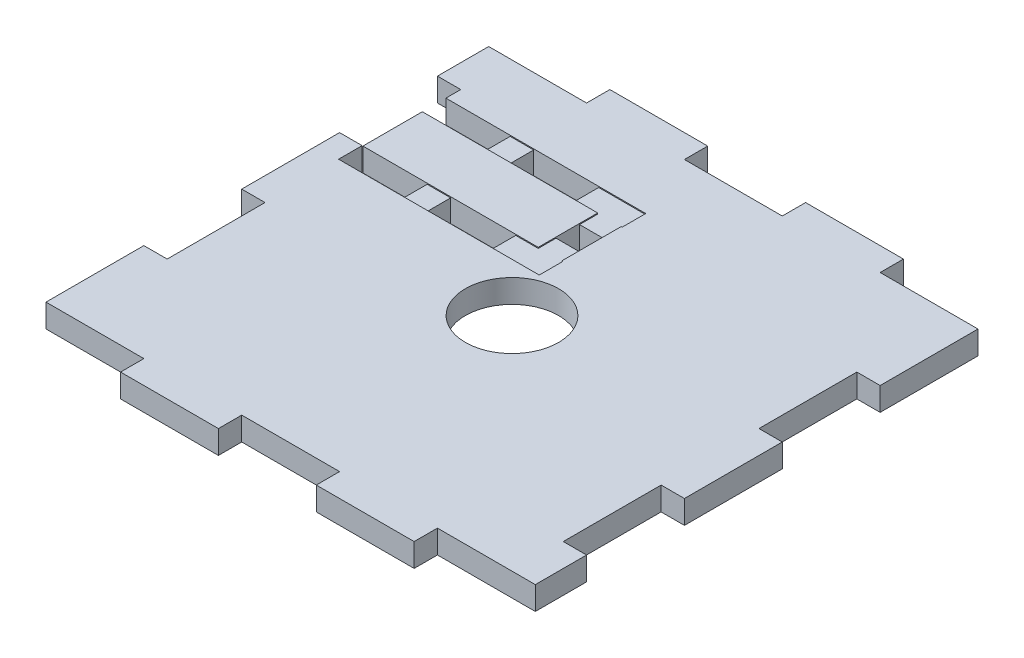
from build123d import *

# Parameters (mm, degrees)
SKETCH1_W           = 100
SKETCH1_H           = 100
BOSS_EXTRUDE1_DEPTH = 4.7625
SKETCH2_W           = 20
SKETCH2_H           = 4.7625
SKETCH2_W_2         = 4.7625
SKETCH2_H_2         = 20
CUT_EXTRUDE1_DEPTH  = 4.7625
SKETCH3_R           = 9.525
CUT_EXTRUDE2_DEPTH  = 71.870878407
CAVITY2_START       = -14.7625
CAVITY2_DEPTH       = 4.810125
CAVITY2_START_2     = -31.725
CAVITY2_2_DEPTH     = 4.810125
CAVITY2_START_3     = -23.2065625
CAVITY2_3_OUTLINE_W = 4.810125
CAVITY2_3_OUTLINE_H = 4.7625
CAVITY2_3_DEPTH     = 4.810125
CAVITY2_START_4     = -26.914875
CAVITY2_4_OUTLINE_W = 4.810125
CAVITY2_4_OUTLINE_H = 0.203
CAVITY2_4_DEPTH     = 12.152375


# Read off the part's stored shape, not the designer's step: Cavity2
with BuildPart() as part:
    # Sketch1 → Boss-Extrude1 (new body)
    with BuildSketch(Plane(origin=(0, 0, 0), x_dir=(1, 0, 0), z_dir=(0, 1, 0))):
        Rectangle(SKETCH1_W, SKETCH1_H)
    extrude(amount=BOSS_EXTRUDE1_DEPTH)

    # Sketch2 → Cut-Extrude1 (cut)
    with BuildSketch(Plane(origin=(0, 4.7625, 0), x_dir=(1, 0, 0), z_dir=(0, 1, 0))):
        Polygon((-50, 45.2375), (-45.2375, 45.2375), (-30, 45.2375), (-30, 50), (-50, 50), align=None)
        with Locations((0, 47.61875)):
            Rectangle(SKETCH2_W, SKETCH2_H)
        Polygon((30, 50), (30, 45.2375), (45.2375, 45.2375), (50, 45.2375), (50, 50), align=None)
        with Locations((47.61875, 15.2375)):
            Rectangle(SKETCH2_W_2, SKETCH2_H_2)
        with Locations((47.61875, -24.7625)):
            Rectangle(SKETCH2_W_2, SKETCH2_H_2)
        Polygon((45.2375, -45.2375), (30, -45.2375), (30, -50), (50, -50), (50, -45.2375), align=None)
        with Locations((0, -47.61875)):
            Rectangle(SKETCH2_W, SKETCH2_H)
        Polygon((-30, -45.2375), (-45.2375, -45.2375), (-50, -45.2375), (-50, -50), (-30, -50), align=None)
        with Locations((-47.61875, -15.2375)):
            Rectangle(SKETCH2_W_2, SKETCH2_H_2)
        with Locations((-47.61875, 24.7625)):
            Rectangle(SKETCH2_W_2, SKETCH2_H_2)
    extrude(amount=-CUT_EXTRUDE1_DEPTH, mode=Mode.SUBTRACT)

    # Sketch3 → Cut-Extrude2 (cut, through all)
    with BuildSketch(Plane(origin=(0, 4.7625, 0), x_dir=(1, 0, 0), z_dir=(0, 1, 0))):
        with Locations(Location((0, 0, 0), (0, 0, 270))):
            Circle(SKETCH3_R)
    extrude(amount=-CUT_EXTRUDE2_DEPTH, mode=Mode.SUBTRACT)

    # Cavity2 outline → Cavity2 (cut)
    with BuildSketch(Plane.XY.offset(CAVITY2_START)):
        Polygon((-4.386875, 4.5595), (-4.386875, 4.7625), (-45.392875, 4.7625), (-45.392875, 0), (-32.1050625, 0), (-32.1050625, 4.5595), (-27.2949375, 4.5595), (-27.2949375, 0), (-14.007125, 0), (-14.007125, 4.5595), align=None)
    extrude(amount=CAVITY2_DEPTH, mode=Mode.SUBTRACT)

    # Cavity2 2 outline → Cavity2 2 (cut)
    with BuildSketch(Plane.XY.offset(CAVITY2_START_2)):
        Polygon((-4.386875, 4.5595), (-4.386875, 4.7625), (-45.2375, 4.7625), (-45.2375, 0), (-32.1050625, 0), (-32.1050625, 4.5595), (-27.2949375, 4.5595), (-27.2949375, 0), (-14.007125, 0), (-14.007125, 4.5595), align=None)
    extrude(amount=CAVITY2_2_DEPTH, mode=Mode.SUBTRACT)

    # Cavity2 3 outline → Cavity2 3 (cut)
    with BuildSketch(Plane.XY.offset(CAVITY2_START_3)):
        with Locations((-6.9949375, 2.38125)):
            Rectangle(CAVITY2_3_OUTLINE_W, CAVITY2_3_OUTLINE_H)
    extrude(amount=CAVITY2_3_DEPTH, mode=Mode.SUBTRACT)

    # Cavity2 4 outline → Cavity2 4 (cut)
    with BuildSketch(Plane.XY.offset(CAVITY2_START_4)):
        with Locations((-6.9949375, 4.661)):
            Rectangle(CAVITY2_4_OUTLINE_W, CAVITY2_4_OUTLINE_H)
    extrude(amount=CAVITY2_4_DEPTH, mode=Mode.SUBTRACT)


solid = part.part
